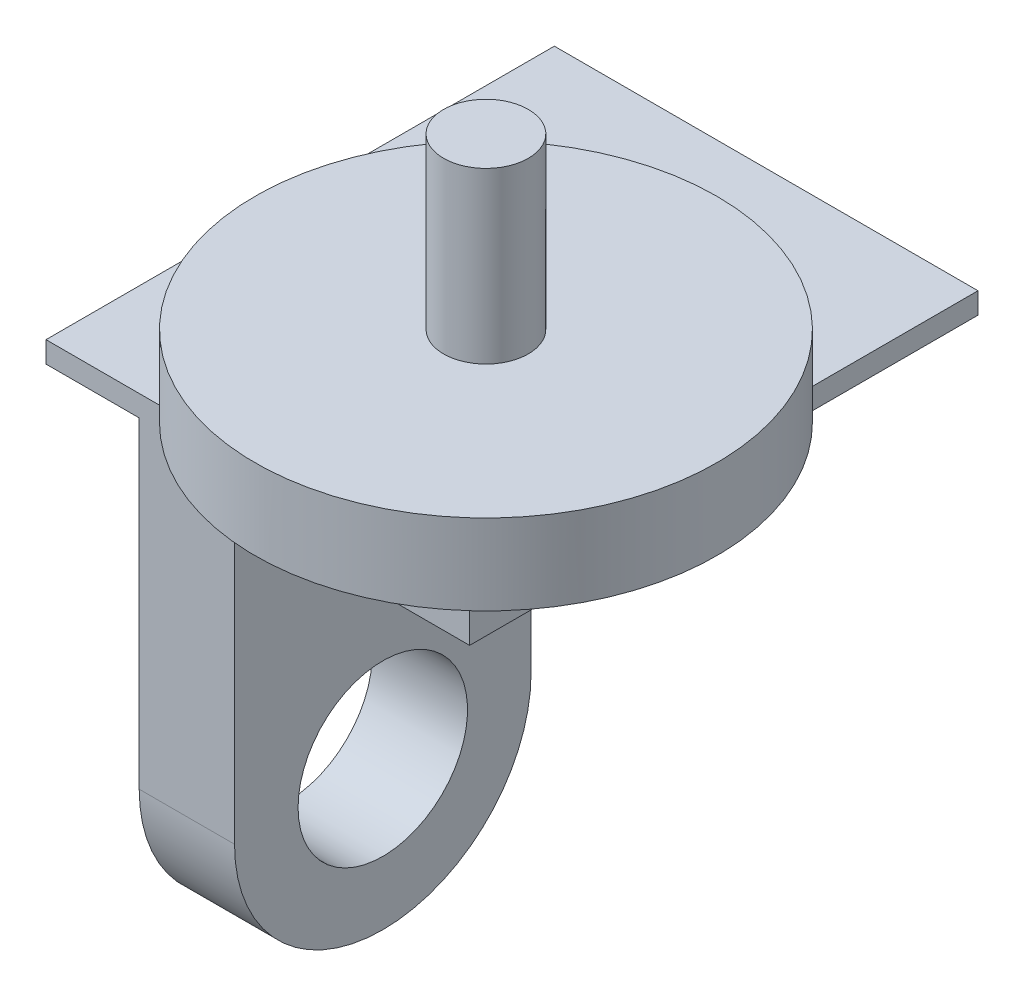
from build123d import *

# Parameters (mm, degrees)
SCHIZZO1_R                   = 40
ESTRUSIONE_ESTRUSIONE1_DEPTH = 45
SCHIZZO2_W                   = 156
SCHIZZO2_H                   = 140
ESTRUSIONE_ESTRUSIONE2_DEPTH = 25
ESTRUSIONE_ESTRUSIONE4_DEPTH = 10


with BuildPart() as part:
    # Schizzo1 → Estrusione-Estrusione1 (new body)
    with BuildSketch(Plane(origin=(0, 0, 0), x_dir=(0, 0, -1), z_dir=(1, 0, 0))):
        with BuildLine():
            Line((-70, 0), (-70, 136.8))
            Line((-70, 136.8), (70, 136.8))
            Line((70, 136.8), (70, 0))
            ThreePointArc((70, 0), (0, -70), (-70, 0))
        make_face()
        Circle(SCHIZZO1_R, mode=Mode.SUBTRACT)
    extrude(amount=ESTRUSIONE_ESTRUSIONE1_DEPTH)

    # Schizzo2 → Estrusione-Estrusione2 (add)
    with BuildSketch(Plane(origin=(0, 136.8, 0), x_dir=(1, 0, 0), z_dir=(0, 1, 0))):
        with Locations((78, 0)):
            Rectangle(SCHIZZO2_W, SCHIZZO2_H)
    extrude(amount=ESTRUSIONE_ESTRUSIONE2_DEPTH)

    # Schizzo5 → Estrusione-Estrusione4 (add)
    with BuildSketch(Plane(origin=(0, 161.8, 0), x_dir=(1, 0, 0), z_dir=(0, 1, 0))):
        Polygon((-44, -70), (0, -70), (0, 70), (156, 70), (156, 170), (-44, 170), align=None)
    extrude(amount=-ESTRUSIONE_ESTRUSIONE4_DEPTH)

    # Schizzo7 → Rivoluzione1 (revolve)
    with BuildSketch(Plane(origin=(93.7, 0, 0), x_dir=(0, 0, -1), z_dir=(1, 0, 0))):
        Polygon((0, 131.8), (48, 131.8), (48, 136.8), (30, 136.8), (30, 161.8), (109, 161.8), (109, 199.8), (20, 199.8), (20, 279.8), (0, 279.8), align=None)
    revolve(axis=Axis((93.7, -1000, 0), (0, 1, 0)))


solid = part.part
